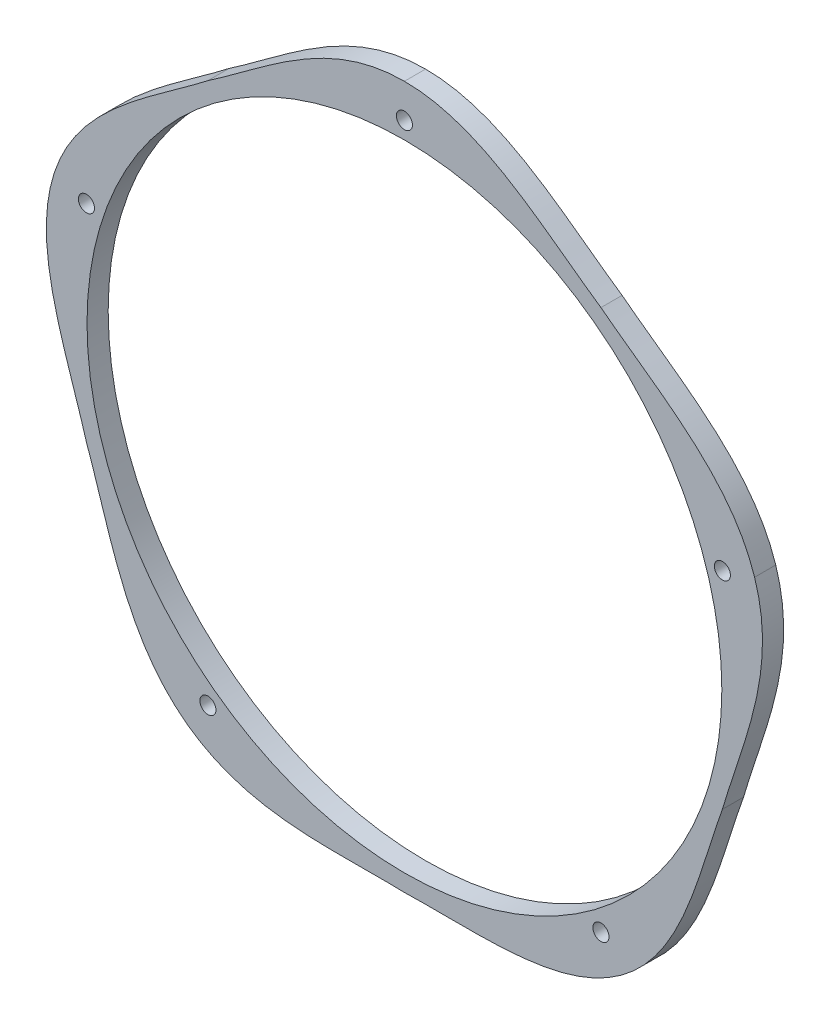
from build123d import *

# Parameters (mm, degrees)
SZKIC1_R                    = 1.9
SZKIC1_R_2                  = 3.2
SZKIC1_R_3                  = 3.3
DODANIE_WYCI_GNI_CIE1_DEPTH = 5
SZKIC2_R                    = 75
WYTNIJ_WYCI_GNI_CIE1_DEPTH  = 5.5


with BuildPart() as part:
    # Szkic1 → Dodanie-wyciągnięcie1 (new body)
    with BuildSketch(Plane.XY):
        with BuildLine():
            add(Edge.make_bspline(
                [(0, 87), (18.224844976, 86.998612649), (32.288902875, 73.536902698), (46.435034931, 63.912342556)],
                knots=[0, 0, 0, 0, 1, 1, 1, 1], degree=3))
            add(Edge.make_bspline(
                [(0, 87), (-18.224844976, 86.998612649), (-32.288902875, 73.536902698), (-46.435034931, 63.912342556)],
                knots=[0, 0, 0, 0, 1, 1, 1, 1], degree=3))
            add(Edge.make_bspline(
                [(-82.741916918, 26.884478511), (-77.108810651, 44.216907368), (-59.959930782, 53.43272413), (-46.435034931, 63.912342556)],
                knots=[0, 0, 0, 0, 1, 1, 1, 1], degree=3))
            add(Edge.make_bspline(
                [(-82.741916918, 26.884478511), (-88.372384286, 9.551192223), (-79.915570217, -7.984418835), (-75.133464787, -24.412342556)],
                knots=[0, 0, 0, 0, 1, 1, 1, 1], degree=3))
            add(Edge.make_bspline(
                [(-51.137316949, -70.384478511), (-65.88071079, -59.671061018), (-69.346178061, -40.513663074), (-75.133464787, -24.412342556)],
                knots=[0, 0, 0, 0, 1, 1, 1, 1], degree=3))
            add(Edge.make_bspline(
                [(-51.137316949, -70.384478511), (-36.39229218, -81.095651222), (-17.10163575, -78.471544919), (0, -79)],
                knots=[0, 0, 0, 0, 1, 1, 1, 1], degree=3))
            add(Edge.make_bspline(
                [(51.137316949, -70.384478511), (36.39229218, -81.095651222), (17.10163575, -78.471544919), (0, -79)],
                knots=[0, 0, 0, 0, 1, 1, 1, 1], degree=3))
            add(Edge.make_bspline(
                [(51.137316949, -70.384478511), (65.88071079, -59.671061018), (69.346178061, -40.513663074), (75.133464787, -24.412342556)],
                knots=[0, 0, 0, 0, 1, 1, 1, 1], degree=3))
            add(Edge.make_bspline(
                [(82.741916918, 26.884478511), (88.372384286, 9.551192223), (79.915570217, -7.984418835), (75.133464787, -24.412342556)],
                knots=[0, 0, 0, 0, 1, 1, 1, 1], degree=3))
            add(Edge.make_bspline(
                [(82.741916918, 26.884478511), (77.108810651, 44.216907368), (59.959930782, 53.43272413), (46.435034931, 63.912342556)],
                knots=[0, 0, 0, 0, 1, 1, 1, 1], degree=3))
        make_face()
        with Locations((-46.435034931, -63.912342556)):
            Circle(SZKIC1_R, mode=Mode.SUBTRACT)
        with BuildLine():
            Line((-41.840826752, -44.09814195), (-29.202311508, -29.918262554))
            ThreePointArc((-29.202311508, -29.918262554), (-26.004934833, -28.273830822), (-22.530809355, -29.20001951))
            Line((-22.530809355, -29.20001951), (-20.144108597, -30.934059112))
            ThreePointArc((-20.144108597, -30.934059112), (-18.189686997, -33.951940742), (-18.765590781, -37.500984015))
            Line((-18.765590781, -37.500984015), (-28.345941486, -53.902750006))
            ThreePointArc((-28.345941486, -53.902750006), (-32.294230369, -56.748559523), (-37.053585893, -55.730644055))
            Line((-37.053585893, -55.730644055), (-40.888447196, -52.94445423))
            ThreePointArc((-40.888447196, -52.94445423), (-43.327264074, -48.732591323), (-41.840826752, -44.09814195))
        make_face(mode=Mode.SUBTRACT)
        with BuildLine():
            Line((-59.726829687, -10.94931483), (-41.167332083, -6.906284292))
            ThreePointArc((-41.167332083, -6.906284292), (-37.614027295, -7.45528193), (-35.347800794, -10.246624039))
            Line((-35.347800794, -10.246624039), (-34.436162226, -13.052359054))
            ThreePointArc((-34.436162226, -13.052359054), (-34.628868252, -16.642656773), (-37.180859496, -19.175385343))
            Line((-37.180859496, -19.175385343), (-54.57224219, -26.813503911))
            ThreePointArc((-54.57224219, -26.813503911), (-59.43919986, -26.795066196), (-62.691283661, -23.174076296))
            Line((-62.691283661, -23.174076296), (-64.156070337, -18.665926459))
            ThreePointArc((-64.156070337, -18.665926459), (-63.653443736, -13.824957196), (-59.726829687, -10.94931483))
        make_face(mode=Mode.SUBTRACT)
        with Locations((0, -25)):
            Circle(SZKIC1_R_2, mode=Mode.SUBTRACT)
        with Locations((-25, 0)):
            Circle(SZKIC1_R_2, mode=Mode.SUBTRACT)
        Circle(SZKIC1_R_3, mode=Mode.SUBTRACT)
        with BuildLine():
            Line((-7.886354704, -60.402977686), (-5.996305076, -41.502481405))
            ThreePointArc((-5.996305076, -41.502481405), (-4.376145729, -38.292737332), (-1.021119125, -37))
            Line((-1.021119125, -37), (1.929005254, -37))
            ThreePointArc((1.929005254, -37), (5.284031858, -38.292737332), (6.904191205, -41.502481405))
            Line((6.904191205, -41.502481405), (8.794240833, -60.402977686))
            ThreePointArc((8.794240833, -60.402977686), (7.272732893, -65.026031925), (2.824017692, -67))
            Line((2.824017692, -67), (-1.916131563, -67))
            ThreePointArc((-1.916131563, -67), (-6.364846764, -65.026031925), (-7.886354704, -60.402977686))
        make_face(mode=Mode.SUBTRACT)
        with BuildLine():
            Line((29.167132204, -53.635928967), (19.586781499, -37.234162977))
            ThreePointArc((19.586781499, -37.234162977), (19.010877715, -33.685119703), (20.965299315, -30.667238074))
            Line((20.965299315, -30.667238074), (23.352000073, -28.933198471))
            ThreePointArc((23.352000073, -28.933198471), (26.826125551, -28.007009784), (30.023502226, -29.651441515))
            Line((30.023502226, -29.651441515), (42.66201747, -43.831320911))
            ThreePointArc((42.66201747, -43.831320911), (44.148454792, -48.465770285), (41.709637914, -52.677633191))
            Line((41.709637914, -52.677633191), (37.874776611, -55.463823017))
            ThreePointArc((37.874776611, -55.463823017), (33.115421087, -56.481738484), (29.167132204, -53.635928967))
        make_face(mode=Mode.SUBTRACT)
        with Locations((46.435034931, -63.912342556)):
            Circle(SZKIC1_R, mode=Mode.SUBTRACT)
        with Locations((25, 0)):
            Circle(SZKIC1_R_2, mode=Mode.SUBTRACT)
        with BuildLine():
            Line((55.166461376, -26.381778402), (37.775078682, -18.743659834))
            ThreePointArc((37.775078682, -18.743659834), (35.223087438, -16.210931263), (35.030381412, -12.620633544))
            Line((35.030381412, -12.620633544), (35.94201998, -9.81489853))
            ThreePointArc((35.94201998, -9.81489853), (38.208246481, -7.023556421), (41.761551269, -6.474558782))
            Line((41.761551269, -6.474558782), (60.321048873, -10.51758932))
            ThreePointArc((60.321048873, -10.51758932), (64.247662922, -13.393231687), (64.750289523, -18.23420095))
            Line((64.750289523, -18.23420095), (63.285502847, -22.742350787))
            ThreePointArc((63.285502847, -22.742350787), (60.033419046, -26.363340686), (55.166461376, -26.381778402))
        make_face(mode=Mode.SUBTRACT)
        with BuildLine():
            Line((-54.712518312, 26.381778402), (-37.321135618, 18.743659834))
            ThreePointArc((-37.321135618, 18.743659834), (-34.769144374, 16.210931263), (-34.576438347, 12.620633544))
            Line((-34.576438347, 12.620633544), (-35.488076916, 9.81489853))
            ThreePointArc((-35.488076916, 9.81489853), (-37.754303417, 7.023556421), (-41.307608204, 6.474558782))
            Line((-41.307608204, 6.474558782), (-59.867105809, 10.51758932))
            ThreePointArc((-59.867105809, 10.51758932), (-63.793719857, 13.393231687), (-64.296346458, 18.23420095))
            Line((-64.296346458, 18.23420095), (-62.831559782, 22.742350787))
            ThreePointArc((-62.831559782, 22.742350787), (-59.579475981, 26.363340686), (-54.712518312, 26.381778402))
        make_face(mode=Mode.SUBTRACT)
        with Locations((-75.133464787, 24.412342556)):
            Circle(SZKIC1_R, mode=Mode.SUBTRACT)
        with BuildLine():
            Line((-28.71318914, 53.635928967), (-19.132838434, 37.234162977))
            ThreePointArc((-19.132838434, 37.234162977), (-18.55693465, 33.685119703), (-20.51135625, 30.667238074))
            Line((-20.51135625, 30.667238074), (-22.898057008, 28.933198471))
            ThreePointArc((-22.898057008, 28.933198471), (-26.372182486, 28.007009784), (-29.569559162, 29.651441515))
            Line((-29.569559162, 29.651441515), (-42.208074406, 43.831320911))
            ThreePointArc((-42.208074406, 43.831320911), (-43.694511727, 48.465770285), (-41.25569485, 52.677633191))
            Line((-41.25569485, 52.677633191), (-37.420833547, 55.463823017))
            ThreePointArc((-37.420833547, 55.463823017), (-32.661478022, 56.481738484), (-28.71318914, 53.635928967))
        make_face(mode=Mode.SUBTRACT)
        with Locations((0, 25)):
            Circle(SZKIC1_R_2, mode=Mode.SUBTRACT)
        with BuildLine():
            Line((1.475062189, 37), (-1.475062189, 37))
            ThreePointArc((-1.475062189, 37), (-4.830088793, 38.292737332), (-6.45024814, 41.502481405))
            Line((-6.45024814, 41.502481405), (-8.340297769, 60.402977686))
            ThreePointArc((-8.340297769, 60.402977686), (-6.818789829, 65.026031925), (-2.370074627, 67))
            Line((-2.370074627, 67), (2.370074627, 67))
            ThreePointArc((2.370074627, 67), (6.818789829, 65.026031925), (8.340297769, 60.402977686))
            Line((8.340297769, 60.402977686), (6.45024814, 41.502481405))
            ThreePointArc((6.45024814, 41.502481405), (4.830088793, 38.292737332), (1.475062189, 37))
        make_face(mode=Mode.SUBTRACT)
        with Locations((0, 79)):
            Circle(SZKIC1_R, mode=Mode.SUBTRACT)
        with BuildLine():
            Line((42.294769817, 44.09814195), (29.656254572, 29.918262554))
            ThreePointArc((29.656254572, 29.918262554), (26.458877897, 28.273830822), (22.984752419, 29.20001951))
            Line((22.984752419, 29.20001951), (20.598051661, 30.934059112))
            ThreePointArc((20.598051661, 30.934059112), (18.643630061, 33.951940742), (19.219533845, 37.500984015))
            Line((19.219533845, 37.500984015), (28.799884551, 53.902750006))
            ThreePointArc((28.799884551, 53.902750006), (32.748173433, 56.748559523), (37.507528958, 55.730644055))
            Line((37.507528958, 55.730644055), (41.34239026, 52.94445423))
            ThreePointArc((41.34239026, 52.94445423), (43.781207138, 48.732591323), (42.294769817, 44.09814195))
        make_face(mode=Mode.SUBTRACT)
        with BuildLine():
            Line((60.180772752, 10.94931483), (41.621275147, 6.906284292))
            ThreePointArc((41.621275147, 6.906284292), (38.06797036, 7.45528193), (35.801743859, 10.246624039))
            Line((35.801743859, 10.246624039), (34.89010529, 13.052359054))
            ThreePointArc((34.89010529, 13.052359054), (35.082811317, 16.642656773), (37.634802561, 19.175385343))
            Line((37.634802561, 19.175385343), (55.026185255, 26.813503911))
            ThreePointArc((55.026185255, 26.813503911), (59.893142924, 26.795066196), (63.145226726, 23.174076296))
            Line((63.145226726, 23.174076296), (64.610013401, 18.665926459))
            ThreePointArc((64.610013401, 18.665926459), (64.1073868, 13.824957196), (60.180772752, 10.94931483))
        make_face(mode=Mode.SUBTRACT)
        with Locations((75.133464787, 24.412342556)):
            Circle(SZKIC1_R, mode=Mode.SUBTRACT)
    extrude(amount=DODANIE_WYCI_GNI_CIE1_DEPTH)

    # Szkic2 → Wytnij-wyciągnięcie1 (cut)
    with BuildSketch(Plane.XY.offset(5)):
        Circle(SZKIC2_R)
    extrude(amount=-WYTNIJ_WYCI_GNI_CIE1_DEPTH, mode=Mode.SUBTRACT)


solid = part.part
